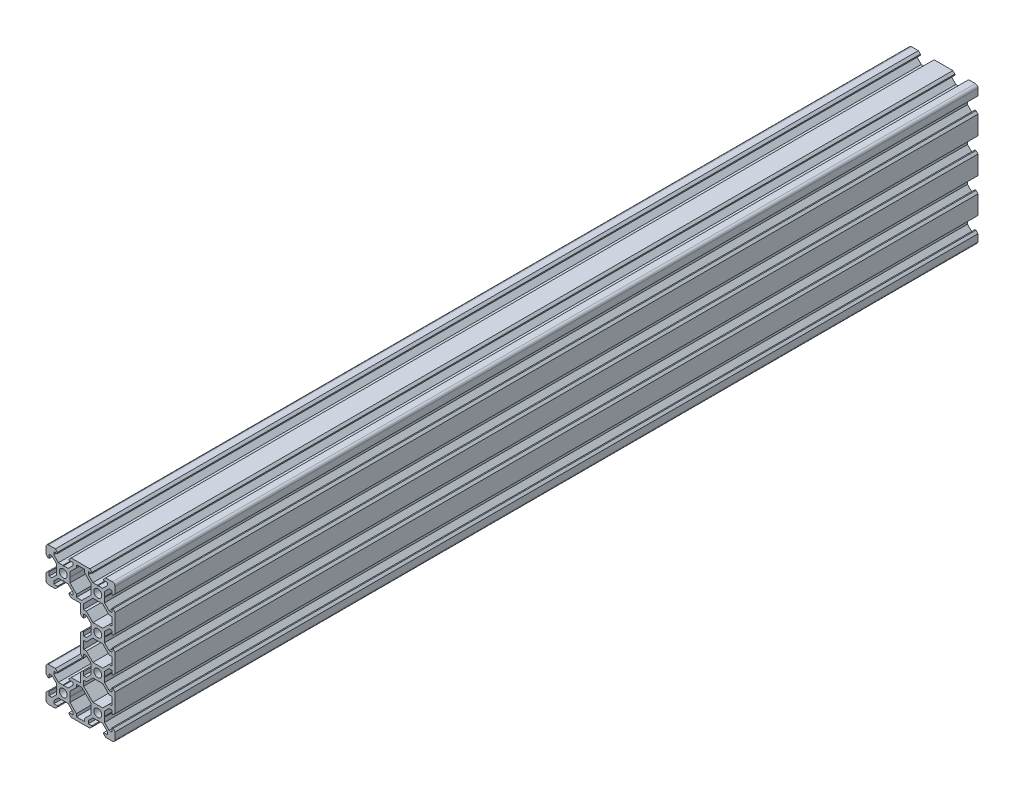
from build123d import *

# Parameters (mm, degrees)
SKETCH1_R           = 2.3
BOSS_EXTRUDE1_DEPTH = 500


with BuildPart() as part:
    # Sketch1 → Boss-Extrude1 (new body)
    with BuildSketch(Plane.XY):
        with BuildLine():
            Line((-3.4, 8.82195881), (-4.57804119, 10))
            Line((-4.57804119, 10), (-8.5, 10))
            ThreePointArc((-8.5, 10), (-9.560660172, 9.560660172), (-10, 8.5))
            Line((-10, 8.5), (-10, 4.57804119))
            Line((-10, 4.57804119), (-8.82195881, 3.4))
            Line((-8.82195881, 3.4), (-8.20195881, 3.4))
            Line((-8.20195881, 3.4), (-8.20195881, 5.499208449))
            Line((-8.20195881, 5.499208449), (-6.561167259, 5.499208449))
            Line((-6.561167259, 5.499208449), (-3.90195881, 2.84))
            Line((-3.90195881, 2.84), (-3.901660414, 0.209714461))
            Line((-3.901660414, 0.209714461), (-3.691952377, 0))
            Line((-3.691952377, 0), (-3.90195881, -0.21))
            Line((-3.90195881, -0.21), (-3.90195881, -2.84))
            Line((-3.90195881, -2.84), (-6.561167259, -5.499208449))
            Line((-6.561167259, -5.499208449), (-8.20195881, -5.499208449))
            Line((-8.20195881, -5.499208449), (-8.20195881, -3.4))
            Line((-8.20195881, -3.4), (-8.82195881, -3.4))
            Line((-8.82195881, -3.4), (-10, -4.57804119))
            Line((-10, -4.57804119), (-10, -8.5))
            ThreePointArc((-10, -8.5), (-9.560660172, -9.560660172), (-8.5, -10))
            Line((-8.5, -10), (-4.57804119, -10))
            Line((-4.57804119, -10), (-3.4, -8.82195881))
            Line((-3.4, -8.82195881), (-3.4, -8.20195881))
            Line((-3.4, -8.20195881), (-5.499208449, -8.20195881))
            Line((-5.499208449, -8.20195881), (-5.499208449, -6.561167259))
            Line((-5.499208449, -6.561167259), (-2.84, -3.90195881))
            Line((-2.84, -3.90195881), (-0.209714461, -3.901660414))
            Line((-0.209714461, -3.901660414), (0, -3.691952377))
            Line((0, -3.691952377), (0.21, -3.90195881))
            Line((0.21, -3.90195881), (2.84, -3.90195881))
            Line((2.84, -3.90195881), (5.499208449, -6.561167259))
            Line((5.499208449, -6.561167259), (5.499208449, -8.20195881))
            Line((5.499208449, -8.20195881), (3.4, -8.20195881))
            Line((3.4, -8.20195881), (3.4, -8.82195881))
            Line((3.4, -8.82195881), (4.57804119, -10))
            Line((4.57804119, -10), (10, -10))
            Line((10, -10), (10, -15.42195881))
            Line((10, -15.42195881), (11.17804119, -16.6))
            Line((11.17804119, -16.6), (11.79804119, -16.6))
            Line((11.79804119, -16.6), (11.79804119, -14.500791551))
            Line((11.79804119, -14.500791551), (13.438832741, -14.500791551))
            Line((13.438832741, -14.500791551), (16.09804119, -17.16))
            Line((16.09804119, -17.16), (16.10195881, -19.79))
            Line((16.10195881, -19.79), (16.31195881, -20))
            Line((16.31195881, -20), (16.10195881, -20.21))
            Line((16.10195881, -20.21), (16.09804119, -22.84))
            Line((16.09804119, -22.84), (13.438832741, -25.499208449))
            Line((13.438832741, -25.499208449), (11.79804119, -25.499208449))
            Line((11.79804119, -25.499208449), (11.79804119, -23.4))
            Line((11.79804119, -23.4), (11.17804119, -23.4))
            Line((11.17804119, -23.4), (10, -24.57804119))
            Line((10, -24.57804119), (10, -35.42195881))
            Line((10, -35.42195881), (11.17804119, -36.6))
            Line((11.17804119, -36.6), (11.79804119, -36.6))
            Line((11.79804119, -36.6), (11.79804119, -34.500791551))
            Line((11.79804119, -34.500791551), (13.438832741, -34.500791551))
            Line((13.438832741, -34.500791551), (16.09804119, -37.16))
            Line((16.09804119, -37.16), (16.10195881, -39.79))
            Line((16.10195881, -39.79), (16.31195881, -40))
            Line((16.31195881, -40), (16.10195881, -40.21))
            Line((16.10195881, -40.21), (16.09804119, -42.84))
            Line((16.09804119, -42.84), (13.438832741, -45.499208449))
            Line((13.438832741, -45.499208449), (11.79804119, -45.499208449))
            Line((11.79804119, -45.499208449), (11.79804119, -43.4))
            Line((11.79804119, -43.4), (11.17804119, -43.4))
            Line((11.17804119, -43.4), (10, -44.57804119))
            Line((10, -44.57804119), (10, -50))
            Line((10, -50), (4.57804119, -50))
            Line((4.57804119, -50), (3.4, -51.17804119))
            Line((3.4, -51.17804119), (3.4, -51.79804119))
            Line((3.4, -51.79804119), (5.499208449, -51.79804119))
            Line((5.499208449, -51.79804119), (5.499208449, -53.438832741))
            Line((5.499208449, -53.438832741), (2.84, -56.09804119))
            Line((2.84, -56.09804119), (0.21, -56.09804119))
            Line((0.21, -56.09804119), (0, -56.308047623))
            Line((0, -56.308047623), (-0.209714461, -56.098339586))
            Line((-0.209714461, -56.098339586), (-2.84, -56.09804119))
            Line((-2.84, -56.09804119), (-5.499208449, -53.438832741))
            Line((-5.499208449, -53.438832741), (-5.499208449, -51.79804119))
            Line((-5.499208449, -51.79804119), (-3.4, -51.79804119))
            Line((-3.4, -51.79804119), (-3.4, -51.17804119))
            Line((-3.4, -51.17804119), (-4.57804119, -50))
            Line((-4.57804119, -50), (-8.5, -50))
            ThreePointArc((-8.5, -50), (-9.560660172, -50.439339828), (-10, -51.5))
            Line((-10, -51.5), (-10, -55.42195881))
            Line((-10, -55.42195881), (-8.82195881, -56.6))
            Line((-8.82195881, -56.6), (-8.20195881, -56.6))
            Line((-8.20195881, -56.6), (-8.20195881, -54.500791551))
            Line((-8.20195881, -54.500791551), (-6.561167259, -54.500791551))
            Line((-6.561167259, -54.500791551), (-3.90195881, -57.16))
            Line((-3.90195881, -57.16), (-3.90195881, -59.79))
            Line((-3.90195881, -59.79), (-3.691952377, -60))
            Line((-3.691952377, -60), (-3.901660414, -60.209714461))
            Line((-3.901660414, -60.209714461), (-3.90195881, -62.84))
            Line((-3.90195881, -62.84), (-6.561167259, -65.499208449))
            Line((-6.561167259, -65.499208449), (-8.20195881, -65.499208449))
            Line((-8.20195881, -65.499208449), (-8.20195881, -63.4))
            Line((-8.20195881, -63.4), (-8.82195881, -63.4))
            Line((-8.82195881, -63.4), (-10, -64.57804119))
            Line((-10, -64.57804119), (-10, -68.5))
            ThreePointArc((-10, -68.5), (-9.560660172, -69.560660172), (-8.5, -70))
            Line((-8.5, -70), (-4.57804119, -70))
            Line((-4.57804119, -70), (-3.4, -68.82195881))
            Line((-3.4, -68.82195881), (-3.4, -68.20195881))
            Line((-3.4, -68.20195881), (-5.499208449, -68.20195881))
            Line((-5.499208449, -68.20195881), (-5.499208449, -66.561167259))
            Line((-5.499208449, -66.561167259), (-2.84, -63.90195881))
            Line((-2.84, -63.90195881), (-0.21, -63.90195881))
            Line((-0.21, -63.90195881), (0, -63.691952377))
            Line((0, -63.691952377), (0.209714461, -63.901660414))
            Line((0.209714461, -63.901660414), (2.84, -63.90195881))
            Line((2.84, -63.90195881), (5.499208449, -66.561167259))
            Line((5.499208449, -66.561167259), (5.499208449, -68.20195881))
            Line((5.499208449, -68.20195881), (3.4, -68.20195881))
            Line((3.4, -68.20195881), (3.4, -68.82195881))
            Line((3.4, -68.82195881), (4.57804119, -70))
            Line((4.57804119, -70), (15.42195881, -70))
            Line((15.42195881, -70), (16.6, -68.82195881))
            Line((16.6, -68.82195881), (16.6, -68.20195881))
            Line((16.6, -68.20195881), (14.500791551, -68.20195881))
            Line((14.500791551, -68.20195881), (14.500791551, -66.561167259))
            Line((14.500791551, -66.561167259), (17.16, -63.90195881))
            Line((17.16, -63.90195881), (19.79, -63.90195881))
            Line((19.79, -63.90195881), (20, -63.69195881))
            Line((20, -63.69195881), (20.21, -63.90195881))
            Line((20.21, -63.90195881), (22.84, -63.90195881))
            Line((22.84, -63.90195881), (25.499208449, -66.561167259))
            Line((25.499208449, -66.561167259), (25.499208449, -68.20195881))
            Line((25.499208449, -68.20195881), (23.4, -68.20195881))
            Line((23.4, -68.20195881), (23.4, -68.82195881))
            Line((23.4, -68.82195881), (24.57804119, -70))
            Line((24.57804119, -70), (28.5, -70))
            ThreePointArc((28.5, -70), (29.560660172, -69.560660172), (30, -68.5))
            Line((30, -68.5), (30, -64.57804119))
            Line((30, -64.57804119), (28.82195881, -63.4))
            Line((28.82195881, -63.4), (28.20195881, -63.4))
            Line((28.20195881, -63.4), (28.20195881, -65.499208449))
            Line((28.20195881, -65.499208449), (26.561167259, -65.499208449))
            Line((26.561167259, -65.499208449), (23.90195881, -62.84))
            Line((23.90195881, -62.84), (23.90195881, -60.21))
            Line((23.90195881, -60.21), (23.69195881, -60))
            Line((23.69195881, -60), (23.90195881, -59.79))
            Line((23.90195881, -59.79), (23.90195881, -57.16))
            Line((23.90195881, -57.16), (26.561167259, -54.500791551))
            Line((26.561167259, -54.500791551), (28.20195881, -54.500791551))
            Line((28.20195881, -54.500791551), (28.20195881, -56.6))
            Line((28.20195881, -56.6), (28.82195881, -56.6))
            Line((28.82195881, -56.6), (30, -55.42195881))
            Line((30, -55.42195881), (30, -44.57804119))
            Line((30, -44.57804119), (28.82195881, -43.4))
            Line((28.82195881, -43.4), (28.177450533, -43.4))
            Line((28.177450533, -43.4), (28.177450533, -45.499208449))
            Line((28.177450533, -45.499208449), (26.536658982, -45.499208449))
            Line((26.536658982, -45.499208449), (23.89804119, -42.860590657))
            Line((23.89804119, -42.860590657), (23.89804119, -40.21))
            Line((23.89804119, -40.21), (23.68804119, -40))
            Line((23.68804119, -40), (23.89804119, -39.79))
            Line((23.89804119, -39.79), (23.89804119, -37.139409343))
            Line((23.89804119, -37.139409343), (26.536658982, -34.500791551))
            Line((26.536658982, -34.500791551), (28.177450533, -34.500791551))
            Line((28.177450533, -34.500791551), (28.177450533, -36.6))
            Line((28.177450533, -36.6), (28.82195881, -36.6))
            Line((28.82195881, -36.6), (30, -35.42195881))
            Line((30, -35.42195881), (30, -24.57804119))
            Line((30, -24.57804119), (28.82195881, -23.4))
            Line((28.82195881, -23.4), (28.177450533, -23.4))
            Line((28.177450533, -23.4), (28.177450533, -25.499208449))
            Line((28.177450533, -25.499208449), (26.536658982, -25.499208449))
            Line((26.536658982, -25.499208449), (23.89804119, -22.860590657))
            Line((23.89804119, -22.860590657), (23.89804119, -20.21))
            Line((23.89804119, -20.21), (23.68804119, -20))
            Line((23.68804119, -20), (23.89804119, -19.79))
            Line((23.89804119, -19.79), (23.89804119, -17.139409343))
            Line((23.89804119, -17.139409343), (26.536658982, -14.500791551))
            Line((26.536658982, -14.500791551), (28.177450533, -14.500791551))
            Line((28.177450533, -14.500791551), (28.177450533, -16.6))
            Line((28.177450533, -16.6), (28.82195881, -16.6))
            Line((28.82195881, -16.6), (30, -15.42195881))
            Line((30, -15.42195881), (30, -4.57804119))
            Line((30, -4.57804119), (28.82195881, -3.4))
            Line((28.82195881, -3.4), (28.20195881, -3.4))
            Line((28.20195881, -3.4), (28.20195881, -5.499208449))
            Line((28.20195881, -5.499208449), (26.561167259, -5.499208449))
            Line((26.561167259, -5.499208449), (23.90195881, -2.84))
            Line((23.90195881, -2.84), (23.90195881, -0.21))
            Line((23.90195881, -0.21), (23.69195881, 0))
            Line((23.69195881, 0), (23.90195881, 0.21))
            Line((23.90195881, 0.21), (23.90195881, 2.84))
            Line((23.90195881, 2.84), (26.561167259, 5.499208449))
            Line((26.561167259, 5.499208449), (28.20195881, 5.499208449))
            Line((28.20195881, 5.499208449), (28.20195881, 3.4))
            Line((28.20195881, 3.4), (28.82195881, 3.4))
            Line((28.82195881, 3.4), (30, 4.57804119))
            Line((30, 4.57804119), (30, 8.5))
            ThreePointArc((30, 8.5), (29.560660172, 9.560660172), (28.5, 10))
            Line((28.5, 10), (24.57804119, 10))
            Line((24.57804119, 10), (23.4, 8.82195881))
            Line((23.4, 8.82195881), (23.4, 8.20195881))
            Line((23.4, 8.20195881), (25.499208449, 8.20195881))
            Line((25.499208449, 8.20195881), (25.499208449, 6.561167259))
            Line((25.499208449, 6.561167259), (22.84, 3.90195881))
            Line((22.84, 3.90195881), (20.21, 3.90195881))
            Line((20.21, 3.90195881), (20, 3.69195881))
            Line((20, 3.69195881), (19.79, 3.90195881))
            Line((19.79, 3.90195881), (17.16, 3.90195881))
            Line((17.16, 3.90195881), (14.500791551, 6.561167259))
            Line((14.500791551, 6.561167259), (14.500791551, 8.20195881))
            Line((14.500791551, 8.20195881), (16.6, 8.20195881))
            Line((16.6, 8.20195881), (16.6, 8.82195881))
            Line((16.6, 8.82195881), (15.42195881, 10))
            Line((15.42195881, 10), (4.57804119, 10))
            Line((4.57804119, 10), (3.4, 8.82195881))
            Line((3.4, 8.82195881), (3.4, 8.20195881))
            Line((3.4, 8.20195881), (5.499208449, 8.20195881))
            Line((5.499208449, 8.20195881), (5.499208449, 6.561167259))
            Line((5.499208449, 6.561167259), (2.84, 3.90195881))
            Line((2.84, 3.90195881), (0.209714461, 3.901660414))
            Line((0.209714461, 3.901660414), (0, 3.691952377))
            Line((0, 3.691952377), (-0.21, 3.90195881))
            Line((-0.21, 3.90195881), (-2.84, 3.90195881))
            Line((-2.84, 3.90195881), (-5.499208449, 6.561167259))
            Line((-5.499208449, 6.561167259), (-5.499208449, 8.20195881))
            Line((-5.499208449, 8.20195881), (-3.4, 8.20195881))
            Line((-3.4, 8.20195881), (-3.4, 8.82195881))
        make_face()
        with Locations((0, -60)):
            Circle(SKETCH1_R, mode=Mode.SUBTRACT)
        Polygon((3.90195881, -62.84), (3.90195881, -60.21), (3.901660414, -59.790285539), (3.90195881, -57.16), (7.712421824, -53.349536986), (7.712421824, -51.82109435), (10.74, -51.82109435), (16.09804119, -57.17913554), (16.09804119, -62.84), (12.377881316, -66.560159874), (12.377881316, -68.201455117), (7.622118684, -68.201455117), (7.622118684, -66.560159874), align=None, mode=Mode.SUBTRACT)
        with Locations((20, -60)):
            Circle(SKETCH1_R, mode=Mode.SUBTRACT)
        with Locations((19.99804119, -40)):
            Circle(SKETCH1_R, mode=Mode.SUBTRACT)
        Polygon((17.16, -43.90195881), (22.885098935, -43.90195881), (26.606266194, -47.623126069), (28.247057744, -47.623126069), (28.247057744, -52.376873931), (26.561167259, -52.376873931), (22.84, -56.09804119), (17.17913554, -56.09804119), (11.82109435, -50.74), (11.82109435, -47.712421824), (13.349536986, -47.712421824), align=None, mode=Mode.SUBTRACT)
        Circle(SKETCH1_R, mode=Mode.SUBTRACT)
        Polygon((3.90195881, 0.21), (3.90195881, 2.84), (7.622118684, 6.560159874), (7.622118684, 8.201455117), (12.377881316, 8.201455117), (12.377881316, 6.560159874), (16.09804119, 2.84), (16.09804119, -2.82086446), (10.74, -8.17890565), (7.712421824, -8.17890565), (7.712421824, -6.650463014), (3.90195881, -2.84), (3.901660414, -0.209714461), align=None, mode=Mode.SUBTRACT)
        with Locations((19.99804119, -20)):
            Circle(SKETCH1_R, mode=Mode.SUBTRACT)
        Polygon((11.82109435, -32.287578176), (11.82109435, -27.712421824), (13.349536986, -27.712421824), (17.16, -23.90195881), (22.885098935, -23.90195881), (26.606266193, -27.623126069), (28.247057744, -27.623126069), (28.247057744, -32.376873931), (26.606266194, -32.376873931), (22.885098935, -36.09804119), (17.16, -36.09804119), (13.349536986, -32.287578176), align=None, mode=Mode.SUBTRACT)
        with Locations((20, 0)):
            Circle(SKETCH1_R, mode=Mode.SUBTRACT)
        Polygon((11.82109435, -12.287578176), (11.82109435, -9.26), (17.17913554, -3.90195881), (22.84, -3.90195881), (26.561167259, -7.623126069), (28.247057744, -7.623126069), (28.247057744, -12.376873931), (26.606266193, -12.376873931), (22.885098935, -16.09804119), (17.16, -16.09804119), (13.349536986, -12.287578176), align=None, mode=Mode.SUBTRACT)
    extrude(amount=-BOSS_EXTRUDE1_DEPTH)


solid = part.part
